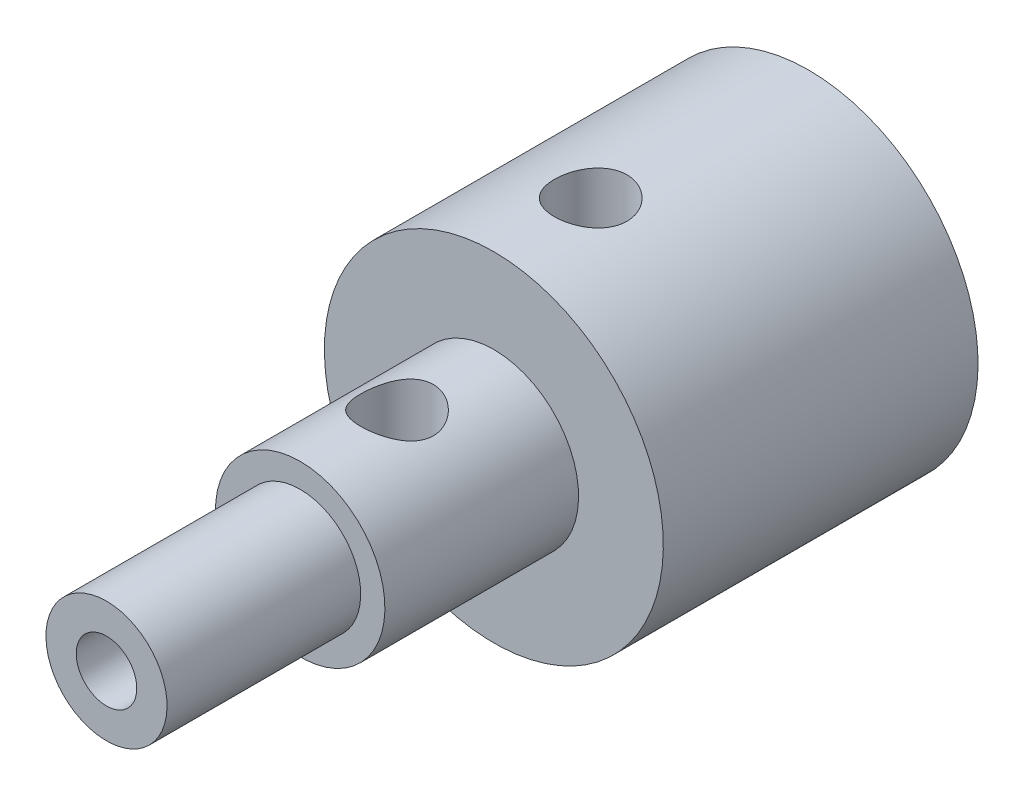
from build123d import *

# Parameters (mm, degrees)
CUT_EXTRUDE1_REACH             = 32.643
SKETCH2_R                      = 1.5
CUT_EXTRUDE1_DIRECTION_2_REACH = 32.643
SKETCH4_R                      = 1.25
CUT_EXTRUDE2_DEPTH             = 10


with BuildPart() as part:
    # Sketch1 → Revolve1 (revolve)
    with BuildSketch(Plane(origin=(0, 0, 0), x_dir=(0, 0, -1), z_dir=(1, 0, 0))):
        Polygon((0, 0), (0, 2.5), (8, 2.5), (8, 3.5), (16, 3.5), (16, 7), (29, 7), (29, 3.2), (18.5, 3.2), (16.577246019, 0), align=None)
    revolve(axis=Axis((0, 0, -16.577246019), (0, 0, 1)))

    # Sketch2 → Cut-Extrude1 (cut, up to next)
    with BuildSketch(Plane(origin=(0, 0, 0), x_dir=(1, 0, 0), z_dir=(0, 1, 0)), mode=Mode.PRIVATE) as cut_extrude1_sk1:
        with Locations((0, 20)):
            Circle(SKETCH2_R)
    cut_extrude1_tool1 = extrude(cut_extrude1_sk1.sketch, amount=-CUT_EXTRUDE1_REACH, mode=Mode.PRIVATE) & part.part
    # Sketch2 → Cut-Extrude1 (cut, up to next)
    with BuildSketch(Plane(origin=(0, 0, 0), x_dir=(1, 0, 0), z_dir=(0, 1, 0)), mode=Mode.PRIVATE) as cut_extrude1_sk2:
        with Locations((0, 12)):
            Circle(SKETCH2_R)
    cut_extrude1_tool2 = extrude(cut_extrude1_sk2.sketch, amount=-CUT_EXTRUDE1_REACH, mode=Mode.PRIVATE) & part.part
    add(cut_extrude1_tool1.solids().sort_by_distance((0, 0, -20))[0], mode=Mode.SUBTRACT)
    add(cut_extrude1_tool2.solids().sort_by_distance((0, 0, -12))[0], mode=Mode.SUBTRACT)

    # Sketch2 → Cut-Extrude1 direction 2 (cut, up to next)
    with BuildSketch(Plane(origin=(0, 0, 0), x_dir=(1, 0, 0), z_dir=(0, 1, 0)), mode=Mode.PRIVATE) as cut_extrude1_direction_2_sk1:
        with Locations((0, 20)):
            Circle(SKETCH2_R)
    cut_extrude1_direction_2_tool1 = extrude(cut_extrude1_direction_2_sk1.sketch, amount=CUT_EXTRUDE1_DIRECTION_2_REACH, mode=Mode.PRIVATE) & part.part
    # Sketch2 → Cut-Extrude1 direction 2 (cut, up to next)
    with BuildSketch(Plane(origin=(0, 0, 0), x_dir=(1, 0, 0), z_dir=(0, 1, 0)), mode=Mode.PRIVATE) as cut_extrude1_direction_2_sk2:
        with Locations((0, 12)):
            Circle(SKETCH2_R)
    cut_extrude1_direction_2_tool2 = extrude(cut_extrude1_direction_2_sk2.sketch, amount=CUT_EXTRUDE1_DIRECTION_2_REACH, mode=Mode.PRIVATE) & part.part
    add(cut_extrude1_direction_2_tool1.solids().sort_by_distance((0, 0, -20))[0], mode=Mode.SUBTRACT)
    add(cut_extrude1_direction_2_tool2.solids().sort_by_distance((0, 0, -12))[0], mode=Mode.SUBTRACT)

    # Sketch4 → Cut-Extrude2 (cut)
    with BuildSketch(Plane.XY):
        Circle(SKETCH4_R)
    extrude(amount=-CUT_EXTRUDE2_DEPTH, mode=Mode.SUBTRACT)


solid = part.part
